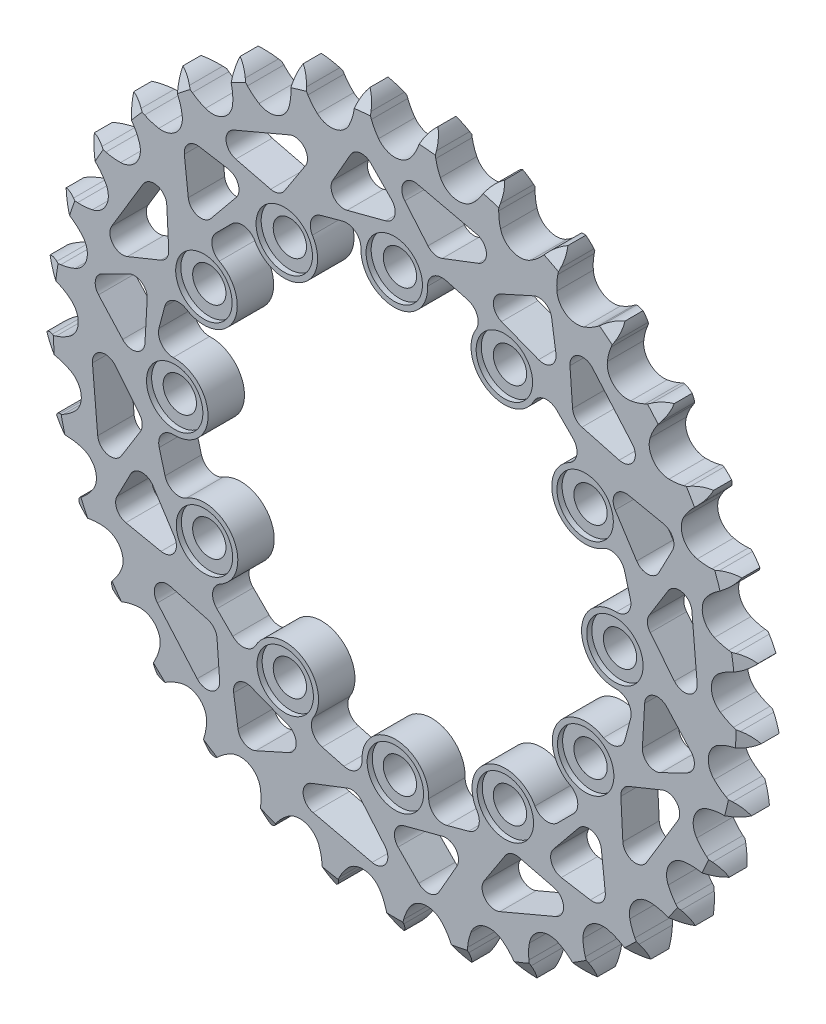
from build123d import *

# Parameters (mm, degrees)
EXTRUSION_DEPTH         = 7.2136
CIRPATTERN1_COUNT       = 12
CUT_EXTRUDE1_DEPTH      = 101.397293257
CUT_EXTRUDE1_DEPTH_BACK = 101.397293257
SKETCH8_R               = 37
CUT_EXTRUDE2_START      = 7.2136
SKETCH10_R              = 5.588
CUT_EXTRUDE2_DEPTH      = 1.016
CIRPATTERN2_COUNT       = 12
CUT_EXTRUDE5_REACH      = 102.397
CIRPATTERN3_COUNT       = 12
CUT_EXTRUDE7_REACH      = 102.397
CIRPATTERN4_COUNT       = 10


with BuildPart() as part:
    # Teeth Sketch → Extrusion (new body)
    with BuildSketch(Plane.XY):
        with BuildLine():
            ThreePointArc((6.734552875, 70.527428506), (5.727412099, 69.369502295), (5.022388138, 68.006393031))
            Line((5.022388138, 68.006393031), (4.635162245, 66.971544668))
            ThreePointArc((4.635162245, 66.971544668), (4.0137299, 65.635158722), (3.209237245, 64.400291471))
            ThreePointArc((3.209237245, 64.400291471), (0, 62.793862006), (-3.209237245, 64.400291471))
            ThreePointArc((-3.209237245, 64.400291471), (-4.0137299, 65.635158722), (-4.635162245, 66.971544668))
            Line((-4.635162245, 66.971544668), (-5.022388138, 68.006393031))
            ThreePointArc((-5.022388138, 68.006393031), (-5.727412099, 69.369502295), (-6.734552875, 70.527428506))
            ThreePointArc((-6.734552875, 70.527428506), (-7.504354329, 69.199824885), (-7.938667464, 67.727922119))
            Line((-7.938667464, 67.727922119), (-8.123049341, 66.638491832))
            ThreePointArc((-8.123049341, 66.638491832), (-8.48033889, 65.208649276), (-9.036593151, 63.84384645))
            ThreePointArc((-9.036593151, 63.84384645), (-11.883816523, 61.659095115), (-15.339077445, 62.629142165))
            ThreePointArc((-15.339077445, 62.629142165), (-16.362732034, 63.68944252), (-17.22584699, 64.884071387))
            Line((-17.22584699, 64.884071387), (-17.801921547, 65.826935709))
            ThreePointArc((-17.801921547, 65.826935709), (-18.752174931, 67.031985151), (-19.960254337, 67.978383482))
            ThreePointArc((-19.960254337, 67.978383482), (-20.464893839, 66.529085505), (-20.61279894, 65.001587639))
            Line((-20.61279894, 65.001587639), (-20.587672758, 63.896950277))
            ThreePointArc((-20.587672758, 63.896950277), (-20.667906137, 62.425329346), (-20.955817525, 60.979918474))
            ThreePointArc((-20.955817525, 60.979918474), (-23.338120953, 58.295807876), (-26.914523421, 58.594412483))
            ThreePointArc((-26.914523421, 58.594412483), (-28.120342399, 59.441823925), (-29.193944743, 60.451518712))
            Line((-29.193944743, 60.451518712), (-29.938047129, 61.268321421))
            ThreePointArc((-29.938047129, 61.268321421), (-31.099185303, 62.271757414), (-32.464540202, 62.972422563))
            ThreePointArc((-32.464540202, 62.972422563), (-32.685778765, 61.453811636), (-32.541930156, 59.925926421))
            Line((-32.541930156, 59.925926421), (-32.308204042, 58.846006456))
            ThreePointArc((-32.308204042, 58.846006456), (-32.108481407, 57.385795366), (-32.117644055, 55.912017363))
            ThreePointArc((-32.117644055, 55.912017363), (-33.948924886, 52.825558252), (-37.517208396, 52.441928068))
            ThreePointArc((-37.517208396, 52.441928068), (-38.861610323, 53.045822938), (-40.106897269, 53.834090646))
            Line((-40.106897269, 53.834090646), (-40.992133685, 54.495310364))
            ThreePointArc((-40.992133685, 54.495310364), (-42.32219009, 55.260866117), (-43.795472998, 55.69047422))
            ThreePointArc((-43.795472998, 55.69047422), (-43.725314484, 54.157436897), (-43.294911229, 52.684386087))
            Line((-43.294911229, 52.684386087), (-42.861032653, 51.668214641))
            ThreePointArc((-42.861032653, 51.668214641), (-42.388572501, 50.272189225), (-42.118655247, 48.823310267))
            ThreePointArc((-42.118655247, 48.823310267), (-43.33272622, 45.446055318), (-46.763923708, 44.394055736))
            ThreePointArc((-46.763923708, 44.394055736), (-48.198318397, 44.732607702), (-49.570282031, 45.270958281))
            Line((-49.570282031, 45.270958281), (-50.564657725, 45.752696804))
            ThreePointArc((-50.564657725, 45.752696804), (-52.015560657, 46.252703137), (-53.543523293, 46.395727039))
            ThreePointArc((-53.543523293, 46.395727039), (-53.184503413, 44.903671283), (-52.483101407, 43.538694772))
            Line((-52.483101407, 43.538694772), (-51.864751871, 42.622998928))
            ThreePointArc((-51.864751871, 42.622998928), (-51.136630142, 41.341615182), (-50.597388499, 39.970001531))
            ThreePointArc((-50.597388499, 39.970001531), (-51.150369926, 36.424013535), (-54.320468976, 34.741666562))
            ThreePointArc((-54.320468976, 34.741666562), (-55.793013665, 34.802639473), (-57.242067645, 35.071615531))
            Line((-57.242067645, 35.071615531), (-58.309643291, 35.356461573))
            ThreePointArc((-58.309643291, 35.356461573), (-59.828953337, 35.572846956), (-61.356371149, 35.424117399))
            ThreePointArc((-61.356371149, 35.424117399), (-60.721465817, 34.026969994), (-59.774415556, 32.819401589))
            Line((-59.774415556, 32.819401589), (-58.993943824, 32.037276981))
            ThreePointArc((-58.993943824, 32.037276981), (-58.036476735, 30.916847451), (-57.2474003, 29.672072798))
            ThreePointArc((-57.2474003, 29.672072798), (-57.119305992, 26.085513002), (-59.913730964, 23.83362304))
            ThreePointArc((-59.913730964, 23.83362304), (-61.371204052, 23.614813176), (-62.844975793, 23.604693218))
            Line((-62.844975793, 23.604693218), (-63.947166423, 23.682351702))
            ThreePointArc((-63.947166423, 23.682351702), (-65.479971761, 23.607295402), (-66.951639889, 23.17218786))
            ThreePointArc((-66.951639889, 23.17218786), (-66.063796239, 21.920445353), (-64.905326586, 20.913929722))
            Line((-64.905326586, 20.913929722), (-63.99094094, 20.293644371))
            ThreePointArc((-63.99094094, 20.293644371), (-62.838733846, 19.374664301), (-61.828341898, 18.301718044))
            ThreePointArc((-61.828341898, 18.301718044), (-61.023801517, 14.804214063), (-63.341554612, 12.064170283))
            ThreePointArc((-63.341554612, 12.064170283), (-64.731279223, 11.573486003), (-66.176502774, 11.28463579))
            Line((-66.176502774, 11.28463579), (-67.273472348, 11.152299936))
            ThreePointArc((-67.273472348, 11.152299936), (-68.764373399, 10.788514683), (-70.127101923, 10.082755077))
            ThreePointArc((-70.127101923, 10.082755077), (-69.018408937, 9.021658703), (-67.690390004, 8.252573944))
            Line((-67.690390004, 8.252573944), (-66.675138724, 7.816546579))
            ThreePointArc((-66.675138724, 7.816546579), (-65.369835391, 7.132230303), (-64.174646128, 6.269891516))
            ThreePointArc((-64.174646128, 6.269891516), (-62.722737859, 2.987852256), (-64.480049441, -0.14131302))
            ThreePointArc((-64.480049441, -0.14131302), (-65.751797307, -0.886137108), (-67.116238523, -1.443277777))
            Line((-67.116238523, -1.443277777), (-68.168339704, -1.780825007))
            ThreePointArc((-68.168339704, -1.780825007), (-69.563451418, -2.420191065), (-70.767987779, -3.371094744))
            ThreePointArc((-70.767987779, -3.371094744), (-69.478516511, -4.203194198), (-68.028946362, -4.707051357))
            Line((-68.028946362, -4.707051357), (-66.949523274, -4.943061572))
            ThreePointArc((-66.949523274, -4.943061572), (-65.538300765, -5.367981082), (-64.201511441, -5.988545228))
            ThreePointArc((-64.201511441, -5.988545228), (-62.154711032, -8.936498316), (-63.288067282, -12.341688903))
            ThreePointArc((-63.288067282, -12.341688903), (-64.395874122, -13.313732915), (-65.630218543, -14.119027525))
            Line((-65.630218543, -14.119027525), (-66.599425651, -14.649586294))
            ThreePointArc((-66.599425651, -14.649586294), (-67.848325057, -15.541424803), (-68.851134172, -16.703104419))
            ThreePointArc((-68.851134172, -16.703104419), (-67.427489473, -17.276132709), (-65.908759351, -17.496551559))
            Line((-65.908759351, -17.496551559), (-64.804177617, -17.524014599))
            ThreePointArc((-64.804177617, -17.524014599), (-63.338041192, -17.674179644), (-61.907966855, -18.030540344))
            ThreePointArc((-61.907966855, -18.030540344), (-59.340251006, -20.537860555), (-59.808689476, -24.096003993))
            ThreePointArc((-59.808689476, -24.096003993), (-60.712516265, -25.260135726), (-61.772151467, -26.284478831))
            Line((-61.772151467, -26.284478831), (-62.623434833, -26.988873364))
            ThreePointArc((-62.623434833, -26.988873364), (-63.680983452, -28.100950955), (-64.445821187, -29.43142038))
            ThreePointArc((-64.445821187, -29.43142038), (-62.939457285, -29.724666771), (-61.406458053, -29.6536808))
            Line((-61.406458053, -29.6536808), (-60.316640136, -29.471604079))
            ThreePointArc((-60.316640136, -29.471604079), (-58.848579784, -29.341587304), (-57.376907048, -29.420864754))
            ThreePointArc((-57.376907048, -29.420864754), (-54.381079699, -31.396931003), (-54.167669802, -34.979426717))
            ThreePointArc((-54.167669802, -34.979426717), (-54.834849884, -36.293571418), (-55.681477891, -37.499940589))
            Line((-55.681477891, -37.499940589), (-56.384069915, -38.352712231))
            ThreePointArc((-56.384069915, -38.352712231), (-57.212045185, -39.644835523), (-57.711268312, -41.096008126))
            ThreePointArc((-57.711268312, -41.096008126), (-56.176629123, -41.09887393), (-54.684767369, -40.739048756))
            Line((-54.684767369, -40.739048756), (-53.649102126, -40.354013001))
            ThreePointArc((-53.649102126, -40.354013001), (-52.232177374, -39.94851355), (-50.772096325, -39.747842457))
            ThreePointArc((-50.772096325, -39.747842457), (-47.456434483, -41.12123456), (-46.56888941, -44.598601821))
            ThreePointArc((-46.56888941, -44.598601821), (-46.975309158, -46.015262876), (-47.578330627, -47.360056788))
            Line((-47.578330627, -47.360056788), (-48.106837804, -48.330384151))
            ThreePointArc((-48.106837804, -48.330384151), (-48.675314541, -49.755852442), (-48.890879835, -51.275279063))
            ThreePointArc((-48.890879835, -51.275279063), (-47.383431219, -50.987660703), (-45.986626711, -50.352001344))
            Line((-45.986626711, -50.352001344), (-45.042545785, -49.777922752))
            ThreePointArc((-45.042545785, -49.777922752), (-43.727967985, -49.111596431), (-42.332249756, -48.638229571))
            ThreePointArc((-42.332249756, -48.638229571), (-38.816590078, -49.35930956), (-37.28698802, -52.605867255))
            ThreePointArc((-37.28698802, -52.605867255), (-37.417958367, -54.073842843), (-37.75557853, -55.50845714))
            Line((-37.75557853, -55.50845714), (-38.090899233, -56.561270064))
            ThreePointArc((-38.090899233, -56.561270064), (-38.379331208, -58.068563217), (-38.303447577, -59.601327819))
            ThreePointArc((-38.303447577, -59.601327819), (-36.877672653, -59.03362057), (-35.626409548, -58.145101414))
            Line((-35.626409548, -58.145101414), (-34.808034481, -57.402728679))
            ThreePointArc((-34.808034481, -57.402728679), (-33.6433159, -56.499658259), (-32.362405386, -55.770704343))
            ThreePointArc((-32.362405386, -55.770704343), (-28.773812973, -55.813410509), (-26.657437732, -58.711819583))
            ThreePointArc((-26.657437732, -58.711819583), (-26.508225068, -60.178053241), (-26.568241455, -61.650637225))
            Line((-26.568241455, -61.650637225), (-26.69825632, -62.747884308))
            ThreePointArc((-26.69825632, -62.747884308), (-26.696218847, -64.28252482), (-26.331628924, -65.773229298))
            ThreePointArc((-26.331628924, -65.773229298), (-25.039058915, -64.94595158), (-23.978561119, -63.836686022))
            Line((-23.978561119, -63.836686022), (-23.31547012, -62.952850431))
            ThreePointArc((-23.31547012, -62.952850431), (-22.342706722, -61.845675228), (-21.222899365, -60.887480551))
            ThreePointArc((-21.222899365, -60.887480551), (-17.691075297, -60.250269381), (-15.06441819, -62.69577378))
            ThreePointArc((-15.06441819, -62.69577378), (-14.640415448, -64.107272002), (-14.42065891, -65.564602652))
            Line((-14.42065891, -65.564602652), (-14.340668861, -66.666626525))
            ThreePointArc((-14.340668861, -66.666626525), (-14.048235582, -68.17314849), (-13.408116596, -69.567914899))
            ThreePointArc((-13.408116596, -69.567914899), (-12.295468348, -68.510966685), (-11.464065017, -67.221046473))
            Line((-11.464065017, -67.221046473), (-10.980223921, -66.227692145))
            ThreePointArc((-10.980223921, -66.227692145), (-10.23457391, -64.956428358), (-9.316342465, -63.80362457))
            ThreePointArc((-9.316342465, -63.80362457), (-5.968936066, -62.509526537), (-2.926931324, -64.413739359))
            ThreePointArc((-2.926931324, -64.413739359), (-2.24346307, -65.719486924), (-1.751876179, -67.108892511))
            Line((-1.751876179, -67.108892511), (-1.464772265, -68.175863162))
            ThreePointArc((-1.464772265, -68.175863162), (-0.89251248, -69.59981695), (0, -70.848234798))
            ThreePointArc((0, -70.848234798), (0.89251248, -69.59981695), (1.464772265, -68.175863162))
            Line((1.464772265, -68.175863162), (1.751876179, -67.108892511))
            ThreePointArc((1.751876179, -67.108892511), (2.24346307, -65.719486924), (2.926931324, -64.413739359))
            ThreePointArc((2.926931324, -64.413739359), (5.968936066, -62.509526537), (9.316342465, -63.80362457))
            ThreePointArc((9.316342465, -63.80362457), (10.23457391, -64.956428358), (10.980223921, -66.227692145))
            Line((10.980223921, -66.227692145), (11.464065017, -67.221046473))
            ThreePointArc((11.464065017, -67.221046473), (12.295468348, -68.510966685), (13.408116596, -69.567914899))
            ThreePointArc((13.408116596, -69.567914899), (14.048235582, -68.17314849), (14.340668861, -66.666626525))
            Line((14.340668861, -66.666626525), (14.42065891, -65.564602652))
            ThreePointArc((14.42065891, -65.564602652), (14.640415448, -64.107272002), (15.06441819, -62.69577378))
            ThreePointArc((15.06441819, -62.69577378), (17.691075297, -60.250269381), (21.222899365, -60.887480551))
            ThreePointArc((21.222899365, -60.887480551), (22.342706722, -61.845675228), (23.31547012, -62.952850431))
            Line((23.31547012, -62.952850431), (23.978561119, -63.836686022))
            ThreePointArc((23.978561119, -63.836686022), (25.039058915, -64.94595158), (26.331628924, -65.773229298))
            ThreePointArc((26.331628924, -65.773229298), (26.696218847, -64.28252482), (26.69825632, -62.747884308))
            Line((26.69825632, -62.747884308), (26.568241455, -61.650637225))
            ThreePointArc((26.568241455, -61.650637225), (26.508225068, -60.178053241), (26.657437732, -58.711819583))
            ThreePointArc((26.657437732, -58.711819583), (28.773812973, -55.813410509), (32.362405386, -55.770704343))
            ThreePointArc((32.362405386, -55.770704343), (33.6433159, -56.499658259), (34.808034481, -57.402728679))
            Line((34.808034481, -57.402728679), (35.626409548, -58.145101414))
            ThreePointArc((35.626409548, -58.145101414), (36.877672653, -59.03362057), (38.303447577, -59.601327819))
            ThreePointArc((38.303447577, -59.601327819), (38.379331208, -58.068563217), (38.090899233, -56.561270064))
            Line((38.090899233, -56.561270064), (37.75557853, -55.50845714))
            ThreePointArc((37.75557853, -55.50845714), (37.417958367, -54.073842843), (37.28698802, -52.605867255))
            ThreePointArc((37.28698802, -52.605867255), (38.816590078, -49.35930956), (42.332249756, -48.638229571))
            ThreePointArc((42.332249756, -48.638229571), (43.727967985, -49.111596431), (45.042545785, -49.777922752))
            Line((45.042545785, -49.777922752), (45.986626711, -50.352001344))
            ThreePointArc((45.986626711, -50.352001344), (47.383431219, -50.987660703), (48.890879835, -51.275279063))
            ThreePointArc((48.890879835, -51.275279063), (48.675314541, -49.755852442), (48.106837804, -48.330384151))
            Line((48.106837804, -48.330384151), (47.578330627, -47.360056788))
            ThreePointArc((47.578330627, -47.360056788), (46.975309158, -46.015262876), (46.56888941, -44.598601821))
            ThreePointArc((46.56888941, -44.598601821), (47.456434483, -41.12123456), (50.772096325, -39.747842457))
            ThreePointArc((50.772096325, -39.747842457), (52.232177374, -39.94851355), (53.649102126, -40.354013001))
            Line((53.649102126, -40.354013001), (54.684767369, -40.739048756))
            ThreePointArc((54.684767369, -40.739048756), (56.176629123, -41.09887393), (57.711268312, -41.096008126))
            ThreePointArc((57.711268312, -41.096008126), (57.212045185, -39.644835523), (56.384069915, -38.352712231))
            Line((56.384069915, -38.352712231), (55.681477891, -37.499940589))
            ThreePointArc((55.681477891, -37.499940589), (54.834849884, -36.293571418), (54.167669802, -34.979426717))
            ThreePointArc((54.167669802, -34.979426717), (54.381079699, -31.396931003), (57.376907048, -29.420864754))
            ThreePointArc((57.376907048, -29.420864754), (58.848579784, -29.341587304), (60.316640136, -29.471604079))
            Line((60.316640136, -29.471604079), (61.406458053, -29.6536808))
            ThreePointArc((61.406458053, -29.6536808), (62.939457285, -29.724666771), (64.445821187, -29.43142038))
            ThreePointArc((64.445821187, -29.43142038), (63.680983452, -28.100950955), (62.623434833, -26.988873364))
            Line((62.623434833, -26.988873364), (61.772151467, -26.284478831))
            ThreePointArc((61.772151467, -26.284478831), (60.712516265, -25.260135726), (59.808689476, -24.096003993))
            ThreePointArc((59.808689476, -24.096003993), (59.340251006, -20.537860555), (61.907966855, -18.030540344))
            ThreePointArc((61.907966855, -18.030540344), (63.338041192, -17.674179644), (64.804177617, -17.524014599))
            Line((64.804177617, -17.524014599), (65.908759351, -17.496551559))
            ThreePointArc((65.908759351, -17.496551559), (67.427489473, -17.276132709), (68.851134172, -16.703104419))
            ThreePointArc((68.851134172, -16.703104419), (67.848325057, -15.541424803), (66.599425651, -14.649586294))
            Line((66.599425651, -14.649586294), (65.630218543, -14.119027525))
            ThreePointArc((65.630218543, -14.119027525), (64.395874122, -13.313732915), (63.288067282, -12.341688903))
            ThreePointArc((63.288067282, -12.341688903), (62.154711032, -8.936498316), (64.201511441, -5.988545228))
            ThreePointArc((64.201511441, -5.988545228), (65.538300765, -5.367981082), (66.949523274, -4.943061572))
            Line((66.949523274, -4.943061572), (68.028946362, -4.707051357))
            ThreePointArc((68.028946362, -4.707051357), (69.478516511, -4.203194198), (70.767987779, -3.371094744))
            ThreePointArc((70.767987779, -3.371094744), (69.563451418, -2.420191065), (68.168339704, -1.780825007))
            Line((68.168339704, -1.780825007), (67.116238523, -1.443277777))
            ThreePointArc((67.116238523, -1.443277777), (65.751797307, -0.886137108), (64.480049441, -0.14131302))
            ThreePointArc((64.480049441, -0.14131302), (62.722737859, 2.987852256), (64.174646128, 6.269891516))
            ThreePointArc((64.174646128, 6.269891516), (65.369835391, 7.132230303), (66.675138724, 7.816546579))
            Line((66.675138724, 7.816546579), (67.690390004, 8.252573944))
            ThreePointArc((67.690390004, 8.252573944), (69.018408937, 9.021658703), (70.127101923, 10.082755077))
            ThreePointArc((70.127101923, 10.082755077), (68.764373399, 10.788514683), (67.273472348, 11.152299936))
            Line((67.273472348, 11.152299936), (66.176502774, 11.28463579))
            ThreePointArc((66.176502774, 11.28463579), (64.731279223, 11.573486003), (63.341554612, 12.064170283))
            ThreePointArc((63.341554612, 12.064170283), (61.023801517, 14.804214063), (61.828341898, 18.301718044))
            ThreePointArc((61.828341898, 18.301718044), (62.838733846, 19.374664301), (63.99094094, 20.293644371))
            Line((63.99094094, 20.293644371), (64.905326586, 20.913929722))
            ThreePointArc((64.905326586, 20.913929722), (66.063796239, 21.920445353), (66.951639889, 23.17218786))
            ThreePointArc((66.951639889, 23.17218786), (65.479971761, 23.607295402), (63.947166423, 23.682351702))
            Line((63.947166423, 23.682351702), (62.844975793, 23.604693218))
            ThreePointArc((62.844975793, 23.604693218), (61.371204052, 23.614813176), (59.913730964, 23.83362304))
            ThreePointArc((59.913730964, 23.83362304), (57.119305992, 26.085513002), (57.2474003, 29.672072798))
            ThreePointArc((57.2474003, 29.672072798), (58.036476735, 30.916847451), (58.993943824, 32.037276981))
            Line((58.993943824, 32.037276981), (59.774415556, 32.819401589))
            ThreePointArc((59.774415556, 32.819401589), (60.721465817, 34.026969994), (61.356371149, 35.424117399))
            ThreePointArc((61.356371149, 35.424117399), (59.828953337, 35.572846956), (58.309643291, 35.356461573))
            Line((58.309643291, 35.356461573), (57.242067645, 35.071615531))
            ThreePointArc((57.242067645, 35.071615531), (55.793013665, 34.802639473), (54.320468976, 34.741666562))
            ThreePointArc((54.320468976, 34.741666562), (51.150369926, 36.424013535), (50.597388499, 39.970001531))
            ThreePointArc((50.597388499, 39.970001531), (51.136630142, 41.341615182), (51.864751871, 42.622998928))
            Line((51.864751871, 42.622998928), (52.483101407, 43.538694772))
            ThreePointArc((52.483101407, 43.538694772), (53.184503413, 44.903671283), (53.543523293, 46.395727039))
            ThreePointArc((53.543523293, 46.395727039), (52.015560657, 46.252703137), (50.564657725, 45.752696804))
            Line((50.564657725, 45.752696804), (49.570282031, 45.270958281))
            ThreePointArc((49.570282031, 45.270958281), (48.198318397, 44.732607702), (46.763923708, 44.394055736))
            ThreePointArc((46.763923708, 44.394055736), (43.33272622, 45.446055318), (42.118655247, 48.823310267))
            ThreePointArc((42.118655247, 48.823310267), (42.388572501, 50.272189225), (42.861032653, 51.668214641))
            Line((42.861032653, 51.668214641), (43.294911229, 52.684386087))
            ThreePointArc((43.294911229, 52.684386087), (43.725314484, 54.157436897), (43.795472998, 55.69047422))
            ThreePointArc((43.795472998, 55.69047422), (42.32219009, 55.260866117), (40.992133685, 54.495310364))
            Line((40.992133685, 54.495310364), (40.106897269, 53.834090646))
            ThreePointArc((40.106897269, 53.834090646), (38.861610323, 53.045822938), (37.517208396, 52.441928068))
            ThreePointArc((37.517208396, 52.441928068), (33.948924886, 52.825558252), (32.117644055, 55.912017363))
            ThreePointArc((32.117644055, 55.912017363), (32.108481407, 57.385795366), (32.308204042, 58.846006456))
            Line((32.308204042, 58.846006456), (32.541930156, 59.925926421))
            ThreePointArc((32.541930156, 59.925926421), (32.685778765, 61.453811636), (32.464540202, 62.972422563))
            ThreePointArc((32.464540202, 62.972422563), (31.099185303, 62.271757414), (29.938047129, 61.268321421))
            Line((29.938047129, 61.268321421), (29.193944743, 60.451518712))
            ThreePointArc((29.193944743, 60.451518712), (28.120342399, 59.441823925), (26.914523421, 58.594412483))
            ThreePointArc((26.914523421, 58.594412483), (23.338120953, 58.295807876), (20.955817525, 60.979918474))
            ThreePointArc((20.955817525, 60.979918474), (20.667906137, 62.425329346), (20.587672758, 63.896950277))
            Line((20.587672758, 63.896950277), (20.61279894, 65.001587639))
            ThreePointArc((20.61279894, 65.001587639), (20.464893839, 66.529085505), (19.960254337, 67.978383482))
            ThreePointArc((19.960254337, 67.978383482), (18.752174931, 67.031985151), (17.801921547, 65.826935709))
            Line((17.801921547, 65.826935709), (17.22584699, 64.884071387))
            ThreePointArc((17.22584699, 64.884071387), (16.362732034, 63.68944252), (15.339077445, 62.629142165))
            ThreePointArc((15.339077445, 62.629142165), (11.883816523, 61.659095115), (9.036593151, 63.84384645))
            ThreePointArc((9.036593151, 63.84384645), (8.48033889, 65.208649276), (8.123049341, 66.638491832))
            Line((8.123049341, 66.638491832), (7.938667464, 67.727922119))
            ThreePointArc((7.938667464, 67.727922119), (7.504354329, 69.199824885), (6.734552875, 70.527428506))
        make_face()
    extrude(amount=EXTRUSION_DEPTH)

    # Sketch7 → M6 Clearance Hole1 (revolve, cut)
    with BuildSketch(Plane(origin=(0, 43.500000122, 0), x_dir=(0, 1, 0), z_dir=(1, 0, 0))):
        Polygon((0, 0), (0, 19.254840043), (3.3, 17.272), (3.3, 0), align=None)
    m6_clearance_hole1 = revolve(axis=Axis((0, 43.500000122, -6.35), (0, 0, 1)), mode=Mode.SUBTRACT)

    # CirPattern1: M6 Clearance Hole1 ×12 about axis
    cirpattern1_axis = Axis((0, -0.110734981, 0), (0, 0, 1))
    for i in range(1, CIRPATTERN1_COUNT):
        add(m6_clearance_hole1.rotate(cirpattern1_axis, i * 360 / CIRPATTERN1_COUNT), mode=Mode.SUBTRACT)

    # Sketch8 → Cut-Extrude1 (cut, two sides: drawn at the far end of the back side and taken through both)
    with BuildSketch(Plane(origin=(0, 0, 0), x_dir=(-1, 0, 0), z_dir=(0, 0, -1)).offset(-CUT_EXTRUDE1_DEPTH_BACK)):
        Circle(SKETCH8_R)
    extrude(amount=CUT_EXTRUDE1_DEPTH + CUT_EXTRUDE1_DEPTH_BACK, mode=Mode.SUBTRACT)

    # Sketch5 → Cut-Revolve1 (revolve, cut)
    with BuildSketch(Plane(origin=(0, 0, 0), x_dir=(0, 0, -1), z_dir=(1, 0, 0))):
        Polygon((-7.2136, -67.654652666), (-7.2136, -70.848234798), (-5.3848, -70.848234798), align=None)
    cut_revolve1 = revolve(axis=Axis((0, 0, 7.2136), (0, 0, -1)), mode=Mode.SUBTRACT)

    # Mirror1: Cut-Revolve1 across plane
    add(cut_revolve1.mirror(Plane.XY.offset(3.6068)), mode=Mode.SUBTRACT)

    # Sketch10 → Cut-Extrude2 (cut)
    with BuildSketch(Plane.XY.offset(CUT_EXTRUDE2_START)):
        with Locations((-43.610735103, -0.110734981)):
            Circle(SKETCH10_R)
    cut_extrude2 = extrude(amount=-CUT_EXTRUDE2_DEPTH, mode=Mode.SUBTRACT)

    # CirPattern2: Cut-Extrude2 ×12 about axis
    cirpattern2_axis = Axis((0, 0, 0), (0, 0, 1))
    for i in range(1, CIRPATTERN2_COUNT):
        add(cut_extrude2.rotate(cirpattern2_axis, i * 360 / CIRPATTERN2_COUNT), mode=Mode.SUBTRACT)

    # Sketch12 → Cut-Extrude5 (cut, up to next)
    with BuildSketch(Plane.XY.offset(7.2136), mode=Mode.PRIVATE) as cut_extrude5_sk1:
        with BuildLine():
            Line((14.388175018, 45.593213658), (10.098898513, 46.730856624))
            ThreePointArc((10.098898513, 46.730856624), (7.595932954, 46.218270023), (6.493200046, 43.913587453))
            ThreePointArc((6.493200046, 43.913587453), (4.669735531, 39.044469772), (-0.110734981, 36.999859413))
            ThreePointArc((-0.110734981, 36.999859413), (9.481789301, 35.74936714), (18.433147254, 32.081473488))
            ThreePointArc((18.433147254, 32.081473488), (15.294353317, 36.226506957), (16.123690397, 41.359296632))
            ThreePointArc((16.123690397, 41.359296632), (16.308098564, 43.907546078), (14.388175018, 45.593213658))
        make_face()
    cut_extrude5_tool1 = extrude(cut_extrude5_sk1.sketch, amount=-CUT_EXTRUDE5_REACH, mode=Mode.PRIVATE) & part.part
    cut_extrude5 = cut_extrude5_tool1.solids().sort_by_distance((10.72122, 40.422415, 7.2136))[0]
    add(cut_extrude5, mode=Mode.SUBTRACT)

    # CirPattern3: Cut-Extrude5 ×12 about axis
    cirpattern3_axis = Axis((0, 0, 0), (0, 0, 1))
    for i in range(1, CIRPATTERN3_COUNT):
        add(cut_extrude5.rotate(cirpattern3_axis, i * 360 / CIRPATTERN3_COUNT), mode=Mode.SUBTRACT)

    # Sketch13 → Cut-Extrude7 (cut, up to next)
    with BuildSketch(Plane.XY.offset(7.2136), mode=Mode.PRIVATE) as cut_extrude7_sk1:
        with BuildLine():
            Line((-12.29503781, 52.699348233), (-8.766956721, 58.874555746))
            ThreePointArc((-8.766956721, 58.874555746), (-6.886929375, 60.133596514), (-4.748676784, 59.393621964))
            Line((-4.748676784, 59.393621964), (-0.656757873, 55.224069994))
            ThreePointArc((-0.656757873, 55.224069994), (-0.020757561, 52.770631729), (-1.823075281, 50.988636624))
            Line((-1.823075281, 50.988636624), (-9.443075281, 48.982981081))
            ThreePointArc((-9.443075281, 48.982981081), (-12.104647123, 49.892965008), (-12.29503781, 52.699348233))
        make_face()
    cut_extrude7_tool1 = extrude(cut_extrude7_sk1.sketch, amount=-CUT_EXTRUDE7_REACH, mode=Mode.PRIVATE) & part.part
    # Sketch13 → Cut-Extrude7 (cut, up to next)
    with BuildSketch(Plane.XY.offset(7.2136), mode=Mode.PRIVATE) as cut_extrude7_sk2:
        with BuildLine():
            Line((1.979717897, 56.320855635), (6.567308468, 50.886285113))
            ThreePointArc((6.567308468, 50.886285113), (7.875401815, 50.064805257), (9.417527045, 50.153050025))
            Line((9.417527045, 50.153050025), (16.53250792, 52.880951625))
            ThreePointArc((16.53250792, 52.880951625), (18.15709085, 55.428778294), (16.195570256, 57.727283763))
            Line((16.195570256, 57.727283763), (4.49299881, 60.433952684))
            ThreePointArc((4.49299881, 60.433952684), (1.753234812, 59.28365705), (1.979717897, 56.320855635))
        make_face()
    cut_extrude7_tool2 = extrude(cut_extrude7_sk2.sketch, amount=-CUT_EXTRUDE7_REACH, mode=Mode.PRIVATE) & part.part
    cut_extrude7_1 = cut_extrude7_tool1.solids().sort_by_distance((-6.467527, 54.029656, 7.2136))[0]
    add(cut_extrude7_1, mode=Mode.SUBTRACT)
    cut_extrude7_2 = cut_extrude7_tool2.solids().sort_by_distance((9.466435, 55.47639, 7.2136))[0]
    add(cut_extrude7_2, mode=Mode.SUBTRACT)
    cut_extrude7 = cut_extrude7_1 + cut_extrude7_2  # Cut-Extrude7 as one shape, for the pattern or mirror that repeats it

    # CirPattern4: Cut-Extrude7 ×10 about axis
    cirpattern4_axis = Axis((0, 0, 0), (0, 0, 1))
    for i in range(1, CIRPATTERN4_COUNT):
        add(cut_extrude7.rotate(cirpattern4_axis, i * 360 / CIRPATTERN4_COUNT), mode=Mode.SUBTRACT)


solid = part.part
